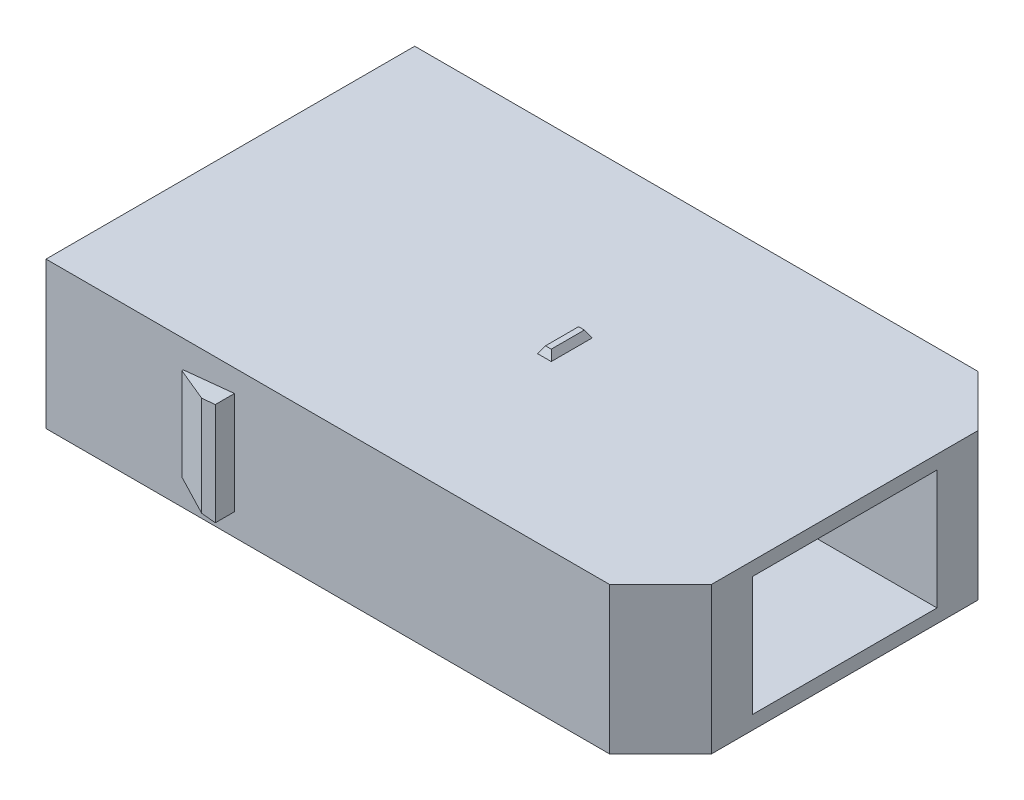
from build123d import *

# Parameters (mm, degrees)
SKETCH1_W           = 22.86
SKETCH1_H           = 13.716
BOSS_EXTRUDE1_DEPTH = 5.461
CHAMFER1_SIZE       = 1.905
SKETCH2_W           = 6.858
SKETCH2_H           = 4.445
CUT_EXTRUDE1_DEPTH  = 5.715
SHELL3_START        = 0.508
SHELL3_DEPTH        = 4.445
SKETCH3_R           = 1.27
CUT_EXTRUDE2_DEPTH  = 23.625255844
SKETCH4_W           = 0.508
SKETCH4_H           = 1.524
BOSS_EXTRUDE2_DEPTH = 0.254
BOSS_EXTRUDE2_TAPER = 30
SKETCH5_W           = 0.508
SKETCH5_H           = 1.524
BOSS_EXTRUDE3_DEPTH = 0.254
BOSS_EXTRUDE3_TAPER = 30
BOSS_EXTRUDE4_DEPTH = 0.7112
CUT_EXTRUDE3_DEPTH  = 28.511138389
BOSS_EXTRUDE6_DEPTH = 0.7112
CUT_EXTRUDE4_DEPTH  = 28.876190112
CUT_EXTRUDE5_REACH  = 28.223
SKETCH11_R          = 0.635
CUT_EXTRUDE6_DEPTH  = 24.12479948


# Read off the part's stored shape, not the designer's step: Shell3
with BuildPart() as part:
    # Sketch1 → Boss-Extrude1 (new body)
    with BuildSketch(Plane(origin=(0, 0, 0), x_dir=(1, 0, 0), z_dir=(0, 1, 0))):
        with Locations((-11.43, 6.858)):
            Rectangle(SKETCH1_W, SKETCH1_H)
    extrude(amount=BOSS_EXTRUDE1_DEPTH)

    # Chamfer1
    chamfer1_edges = [part.edges().sort_by_distance(p)[0] for p in [
        (0, 2.7305, 0),
        (0, 2.7305, -13.716),
    ]]
    chamfer(chamfer1_edges, length=CHAMFER1_SIZE)

    # Sketch2 → Cut-Extrude1 (cut)
    with BuildSketch(Plane(origin=(0, 0, 0), x_dir=(0, 0, -1), z_dir=(1, 0, 0))):
        with Locations((6.858, 2.7305)):
            Rectangle(SKETCH2_W, SKETCH2_H)
    extrude(amount=-CUT_EXTRUDE1_DEPTH, mode=Mode.SUBTRACT)

    # Shell3 outline → Shell3 (cut)
    with BuildSketch(Plane(origin=(0, 0, 0), x_dir=(1, 0, 0), z_dir=(0, 1, 0)).offset(SHELL3_START)):
        Polygon((-0.508, 2.11542049), (-0.508, 2.921), (-6.223, 2.921), (-6.223, 10.795), (-0.508, 10.795), (-0.508, 11.60057951), (-2.11542049, 13.208), (-22.86, 13.208), (-22.86, 0.508), (-2.11542049, 0.508), align=None)
    extrude(amount=SHELL3_DEPTH, mode=Mode.SUBTRACT)

    # Sketch3 → Cut-Extrude2 (cut, through all)
    with BuildSketch(Plane(origin=(-5.715, 0, 0), x_dir=(0, 0, -1), z_dir=(1, 0, 0))):
        with Locations((6.858, 2.7305)):
            Circle(SKETCH3_R)
    extrude(amount=-CUT_EXTRUDE2_DEPTH, mode=Mode.SUBTRACT)

    # Sketch4 → Boss-Extrude2 (add)
    with BuildSketch(Plane(origin=(0, 5.461, 0), x_dir=(1, 0, 0), z_dir=(0, 1, 0))):
        with Locations((-10.414, 6.858)):
            Rectangle(SKETCH4_W, SKETCH4_H)
    extrude(amount=BOSS_EXTRUDE2_DEPTH, taper=BOSS_EXTRUDE2_TAPER)

    # Sketch5 → Boss-Extrude3 (add)
    with BuildSketch(Plane.XZ):
        with Locations((-10.414, -6.858)):
            Rectangle(SKETCH5_W, SKETCH5_H)
    extrude(amount=BOSS_EXTRUDE3_DEPTH, taper=BOSS_EXTRUDE3_TAPER)

    # Sketch6 → Boss-Extrude4 (add)
    with BuildSketch(Plane.XY):
        Polygon((-15.8496, 0.8255), (-15.8496, 4.6355), (-17.7546, 4.445), (-17.7546, 1.016), align=None)
    extrude(amount=BOSS_EXTRUDE4_DEPTH)

    # Sketch7 → Cut-Extrude3 (cut, through all, along a direction that is not the sketch's normal)
    with BuildSketch(Plane(origin=(-0.075194059, -0.751940594, 0), x_dir=(-0.9950371902099893, 0.09950371902099862, 0), z_dir=(-0.09950371902099861, -0.9950371902099892, 0))):
        Polygon((17.767583076, -0.0508), (16.36108177, -0.7112), (17.767583076, -0.7112), align=None)
    extrude(amount=-CUT_EXTRUDE3_DEPTH, dir=(0, -1, 0), mode=Mode.SUBTRACT)

    # Sketch9 → Boss-Extrude6 (add)
    with BuildSketch(Plane(origin=(0, 0, -13.716), x_dir=(-1, 0, 0), z_dir=(0, 0, -1))):
        Polygon((17.7546, 1.016), (15.8496, 0.8255), (15.8496, 4.6355), (17.7546, 4.445), align=None)
    extrude(amount=BOSS_EXTRUDE6_DEPTH)

    # Sketch10 → Cut-Extrude4 (cut, through all, along a direction that is not the sketch's normal)
    with BuildSketch(Plane(origin=(-0.075194059, -0.751940594, 0), x_dir=(0.9950371902099892, -0.09950371902099901, 0), z_dir=(-0.09950371902099903, -0.9950371902099893, 0))):
        Polygon((-16.36108177, -14.4272), (-17.767583076, -13.843), (-17.767583076, -14.4272), align=None)
    extrude(amount=-CUT_EXTRUDE4_DEPTH, dir=(0, -1, 0), mode=Mode.SUBTRACT)

    # Cut-Extrude5: up to this face of the body (flat: up to its plane)
    cut_extrude5_end = Plane(part.part.faces().sort_by_distance((-12.487710245, 2.7305, -13.208))[0])
    # Sketch11 → Cut-Extrude5 (cut, up to the picked face)
    with BuildSketch(Plane.XY.offset(-2.921), mode=Mode.PRIVATE) as cut_extrude5_sk1:
        with Locations(Location((-3.461534283, 2.805193331, 0), (0, 0, 180))):
            Circle(SKETCH11_R)
    cut_extrude5_tool1 = split(extrude(cut_extrude5_sk1.sketch, amount=-CUT_EXTRUDE5_REACH, mode=Mode.PRIVATE), bisect_by=cut_extrude5_end, keep=Keep.BOTH, mode=Mode.PRIVATE)
    add(cut_extrude5_tool1.solids().sort_by(Axis((-3.461534, 2.805193, -2.921), (0, 0, -1)))[0], mode=Mode.SUBTRACT)

    # Sketch12 → Cut-Extrude6 (cut, through all)
    with BuildSketch(Plane(origin=(-5.715, 0, 0), x_dir=(0, 0, -1), z_dir=(1, 0, 0))):
        with BuildLine():
            Line((5.969, 3.63746141), (5.969, 4.295230705))
            Line((5.969, 4.295230705), (7.747, 4.295230705))
            Line((7.747, 4.295230705), (7.747, 3.63746141))
            ThreePointArc((7.747, 3.63746141), (6.858, 4.0005), (5.969, 3.63746141))
        make_face()
        with BuildLine():
            Line((5.969, 1.82353859), (5.969, 1.165769295))
            Line((5.969, 1.165769295), (7.747, 1.165769295))
            Line((7.747, 1.165769295), (7.747, 1.82353859))
            ThreePointArc((7.747, 1.82353859), (6.858, 1.4605), (5.969, 1.82353859))
        make_face()
    extrude(amount=-CUT_EXTRUDE6_DEPTH, mode=Mode.SUBTRACT)


solid = part.part
